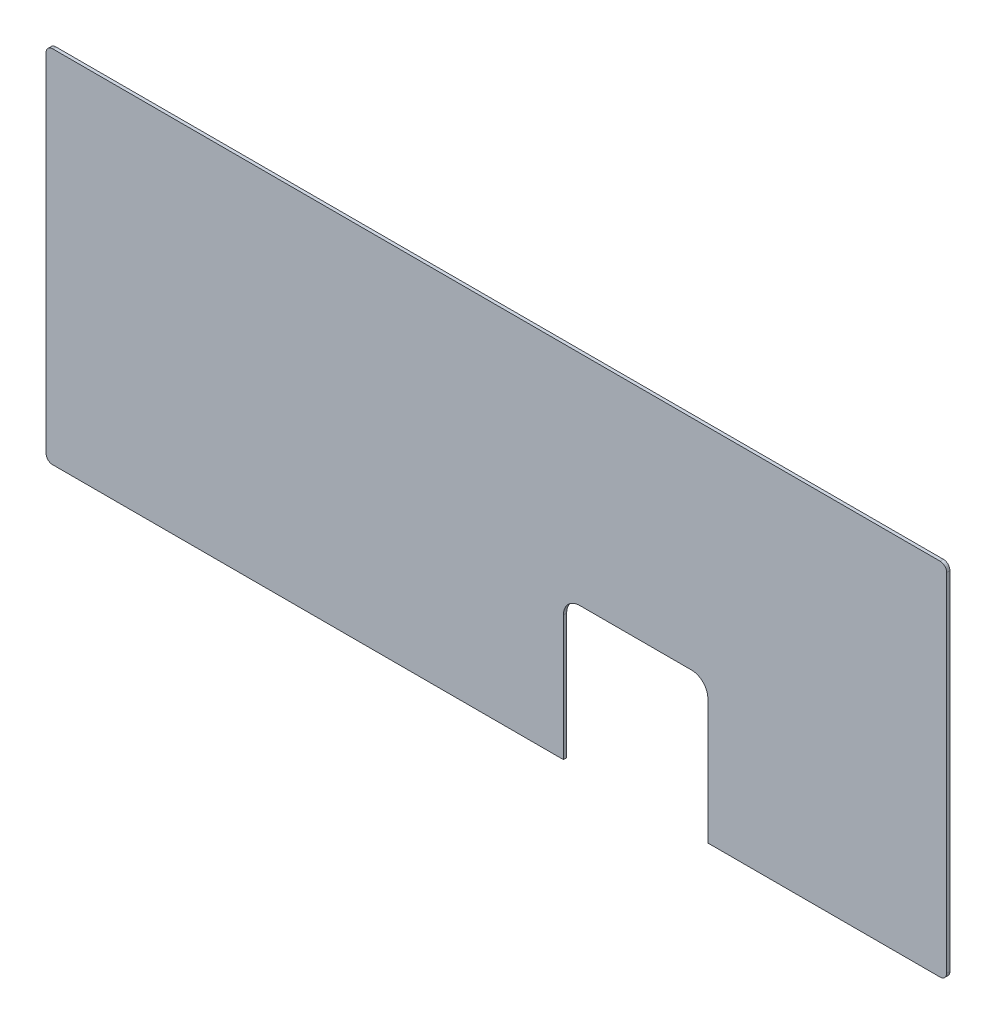
from build123d import *

# Parameters (mm, degrees)
SM_BASE_FLANGE_1_DEPTH = 1


# Sheet-metal steps are written as plain solids
with BuildPart() as part:
    # Sketch 1 → Базовая кромка1 (new body)
    with BuildSketch(Plane.XY):
        with BuildLine():
            Line((89.221000297, -66.773952096), (89.221000297, -28.520742394))
            ThreePointArc((89.221000297, -28.520742394), (90.685466391, -24.985208488), (94.221000297, -23.520742394))
            Line((94.221000297, -23.520742394), (128.329321471, -23.520742394))
            ThreePointArc((128.329321471, -23.520742394), (131.864855377, -24.985208488), (133.329321471, -28.520742394))
            Line((133.329321471, -28.520742394), (133.329321471, -66.773952096))
            Line((133.329321471, -66.773952096), (204.25, -66.773952096))
            ThreePointArc((204.25, -66.773952096), (205.664213562, -66.188165658), (206.25, -64.773952096))
            Line((206.25, -64.773952096), (206.25, 41.226047904))
            ThreePointArc((206.25, 41.226047904), (205.664213562, 42.640261467), (204.25, 43.226047904))
            Line((204.25, 43.226047904), (-66.75, 43.226047904))
            ThreePointArc((-66.75, 43.226047904), (-68.164213562, 42.640261467), (-68.75, 41.226047904))
            Line((-68.75, 41.226047904), (-68.75, -64.773952096))
            ThreePointArc((-68.75, -64.773952096), (-68.164213562, -66.188165658), (-66.75, -66.773952096))
            Line((-66.75, -66.773952096), (89.221000297, -66.773952096))
        make_face()
    extrude(amount=-SM_BASE_FLANGE_1_DEPTH)


solid = part.part
